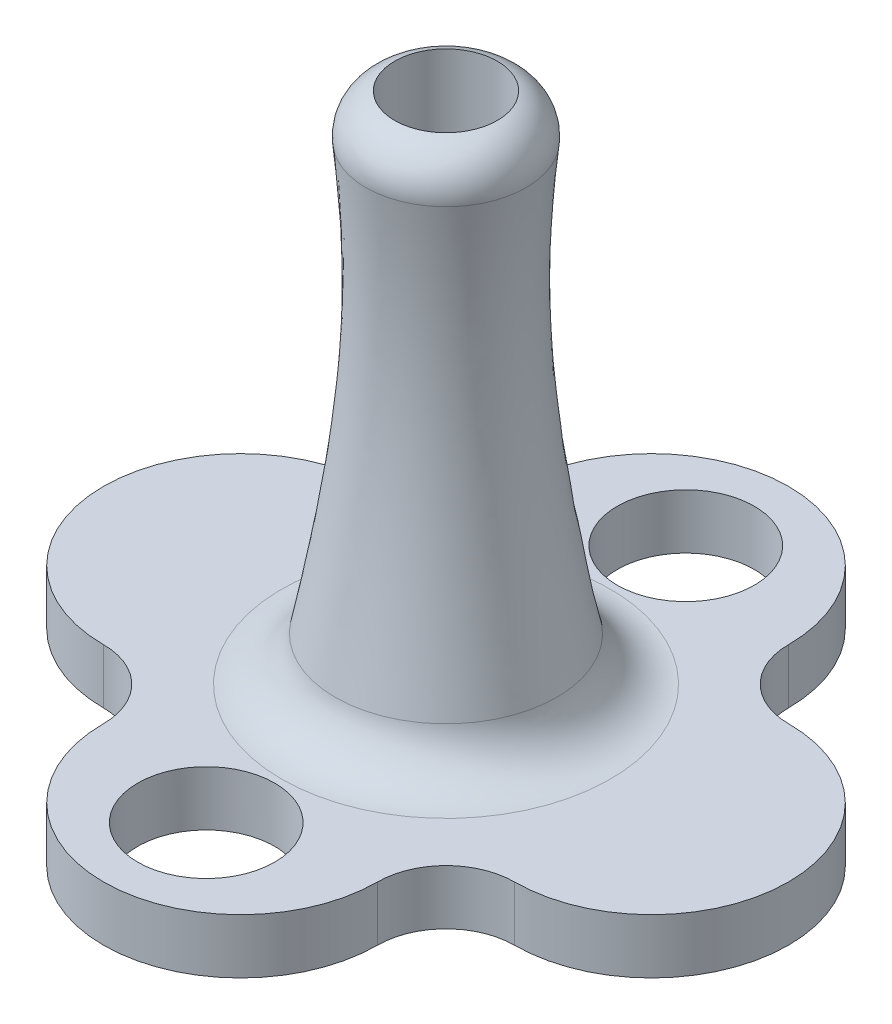
from build123d import *

# Parameters (mm, degrees)
BOSS_EXTRUDE1_DEPTH = 2.032
FILLET1_R           = 2.54
SKETCH4_R           = 1.905
CUT_EXTRUDE1_DEPTH  = 19.05
SKETCH5_R           = 2.54
CUT_EXTRUDE2_DEPTH  = 2.032
FILLET6_R           = 2.032


with BuildPart() as part:
    # Sketch1 → Boss-Extrude1 (new body)
    with BuildSketch(Plane(origin=(0, 0, 0), x_dir=(1, 0, 0), z_dir=(0, 1, 0))):
        with BuildLine():
            Line((-5.08, -7.62), (-5.08, -5.08))
            Line((-5.08, -5.08), (-7.62, -5.08))
            ThreePointArc((-7.62, -5.08), (-12.7, 0), (-7.62, 5.08))
            Line((-7.62, 5.08), (-5.08, 5.08))
            Line((-5.08, 5.08), (-5.08, 7.62))
            ThreePointArc((-5.08, 7.62), (0, 12.7), (5.08, 7.62))
            Line((5.08, 7.62), (5.08, 5.08))
            Line((5.08, 5.08), (7.62, 5.08))
            ThreePointArc((7.62, 5.08), (12.7, 0), (7.62, -5.08))
            Line((7.62, -5.08), (5.08, -5.08))
            Line((5.08, -5.08), (5.08, -7.62))
            ThreePointArc((5.08, -7.62), (0, -12.7), (-5.08, -7.62))
        make_face()
    extrude(amount=BOSS_EXTRUDE1_DEPTH)

    # Fillet1
    fillet1_edges = [part.edges().sort_by_distance(p)[0] for p in [
        (-5.08, 1.016, -5.08),
        (-5.08, 1.016, 5.08),
        (5.08, 1.016, 5.08),
        (5.08, 1.016, -5.08),
    ]]
    fillet(fillet1_edges, radius=FILLET1_R - 0.0001)  # a hair under: the kernel refuses the full size

    # Loft1: read off the stored shape, not the designer's step
    # Loft1: loft between two sections, ruled curve by curve
    loft1_from = [
        Edge.make_bspline([(-4.412357467, 2.032, 0.537704925), (-3.336947617, 2.032, 9.362419858), (5.487767316, 2.032, 8.287010009), (4.412357467, 2.032, -0.537704925), (3.336947617, 2.032, -9.362419858), (-5.487767316, 2.032, -8.287010009), (-4.412357467, 2.032, 0.537704925)], [0, 0, 0, 0, 0.5, 0.5, 0.5, 1, 1, 1, 1], 3, [1, 0.333333333, 0.333333333, 1, 0.333333333, 0.333333333, 1]),
    ]
    loft1_to = [
        Edge.make_bspline([(0.017954106, 21.082, 3.174949236), (6.367852578, 21.082, 3.139041023), (6.331944365, 21.082, -3.210857448), (-0.017954106, 21.082, -3.174949236), (-6.367852578, 21.082, -3.139041023), (-6.331944365, 21.082, 3.210857448), (0.017954106, 21.082, 3.174949236)], [0, 0, 0, 0, 0.5, 0.5, 0.5, 1, 1, 1, 1], 3, [1, 0.333333333, 0.333333333, 1, 0.333333333, 0.333333333, 1]),
    ]
    loft1 = Solid(Shell([*[Face.make_surface_from_curves(loft1_from[k], loft1_to[k]) for k in range(1)], Face(Wire(loft1_from)), Face(Wire(loft1_to))]))
    add(loft1)

    # Sketch4 → Cut-Extrude1 (cut)
    with BuildSketch(Plane(origin=(0, 21.082, 0), x_dir=(1, 0, 0), z_dir=(0, 1, 0))):
        with Locations(Location((0, 0, 0), (0, 0, 270))):
            Circle(SKETCH4_R)
    extrude(amount=-CUT_EXTRUDE1_DEPTH, mode=Mode.SUBTRACT)

    # Sketch5 → Cut-Extrude2 (cut)
    with BuildSketch(Plane(origin=(0, 2.032, 0), x_dir=(1, 0, 0), z_dir=(0, 1, 0))):
        with Locations(Location((0, 8.89, 0), (0, 0, 270))):
            Circle(SKETCH5_R)
        with Locations(Location((0, -8.89, 0), (0, 0, 270))):
            Circle(SKETCH5_R)
    extrude(amount=-CUT_EXTRUDE2_DEPTH, mode=Mode.SUBTRACT)

    # Fillet6
    fillet6_edges = [part.edges().sort_by_distance(p)[0] for p in [
        (4.412357467, 2.032, -0.537704925),
    ]]
    fillet(fillet6_edges, radius=FILLET6_R)

    # Fillet7: read off the stored shape, not the designer's step
    # Fillet7 outline → Fillet7 (revolve, cut)
    with BuildSketch(Plane.XY):
        with BuildLine():
            Line((2.972160789, 19.459683195), (3.175, 19.459683195))
            Line((3.175, 19.459683195), (3.175, 21.082))
            Line((3.175, 21.082), (1.905, 21.082))
            ThreePointArc((1.905, 21.082), (2.730414906, 20.462810482), (2.972160789, 19.459683195))
        make_face()
    revolve(axis=Axis((0, 0, 0), (0, 1, 0)), mode=Mode.SUBTRACT)


solid = part.part
